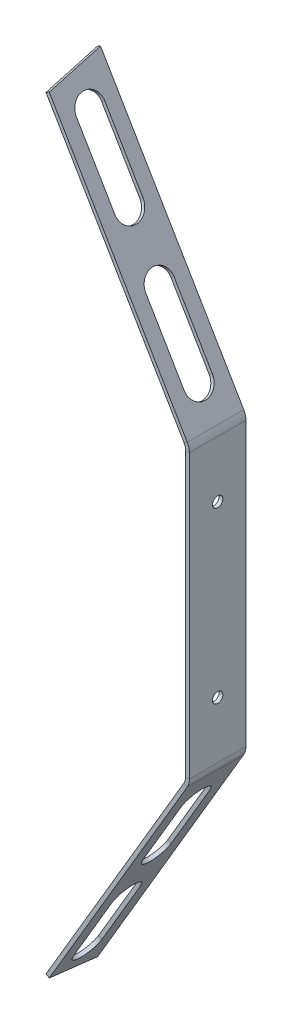
from build123d import *

# Parameters (mm, degrees)
ODGI_CIE_BAZOWE1_DEPTH      = 30
OTW_R_POD_RUB_M51_D         = 5.5
OTW_R_POD_RUB_M51_DEPTH     = 14
OTW_R_POD_RUB_M51_TIP       = 1.652366702
DODANIE_WYCI_GNI_CIE1_DEPTH = 2
DODANIE_WYCI_GNI_CIE2_DEPTH = 2
WYTNIJ_WYCI_GNI_CIE1_DEPTH  = 10
WYTNIJ_WYCI_GNI_CIE3_DEPTH  = 10


# Sheet-metal steps are written as plain solids
with BuildPart() as part:
    # Szkic1 → Odgięcie bazowe1 (new body)
    with BuildSketch(Plane.XY):
        with BuildLine():
            Line((0, 405.16), (73.22194051, 280.801279174))
            ThreePointArc((73.22194051, 280.801279174), (73.876553772, 279.249103741), (74.1, 277.579421472))
            Line((74.1, 277.579421472), (74.1, 127.580578528))
            ThreePointArc((74.1, 127.580578528), (73.876553772, 125.910896259), (73.22194051, 124.358720826))
            Line((73.22194051, 124.358720826), (0, 0))
            Line((0, 0), (1.72344583, -1.014758331))
            Line((1.72344583, -1.014758331), (74.94538634, 123.343962495))
            ThreePointArc((74.94538634, 123.343962495), (75.806177007, 125.38501208), (76.1, 127.580578528))
            Line((76.1, 127.580578528), (76.1, 277.579421472))
            ThreePointArc((76.1, 277.579421472), (75.806177007, 279.77498792), (74.94538634, 281.816037505))
            Line((74.94538634, 281.816037505), (1.72344583, 406.174758331))
            Line((1.72344583, 406.174758331), (0, 405.16))
        make_face()
    extrude(amount=ODGI_CIE_BAZOWE1_DEPTH)

    # Otwór pod śrubę M51
    with Locations(Plane(origin=(76.1, 0, 0), x_dir=(0, 0, -1), z_dir=(1, 0, 0))):
        with Locations((-15, 157.580578528), (-15, 247.579421472)):
            Hole(OTW_R_POD_RUB_M51_D / 2, depth=OTW_R_POD_RUB_M51_DEPTH)
            with Locations((0, 0, -(OTW_R_POD_RUB_M51_DEPTH + OTW_R_POD_RUB_M51_TIP / 2))):  # 118° drill point
                Cone(0, OTW_R_POD_RUB_M51_D / 2, OTW_R_POD_RUB_M51_TIP, mode=Mode.SUBTRACT)

    # Szkic10 → Dodanie-wyciągnięcie1 (add)
    with BuildSketch(Plane(origin=(178.867603803, 105.316562907, 0), x_dir=(0, 0, -1), z_dir=(0.8617229149967045, 0.5073791656833994, 0))):
        Polygon((-30, 349.13565624), (-0.000160653, 354.682794047), (0, 349.13565624), align=None)
    extrude(amount=-DODANIE_WYCI_GNI_CIE1_DEPTH)

    # Szkic11 → Dodanie-wyciągnięcie2 (add)
    with BuildSketch(Plane(origin=(1.72344583, -1.014758331, 0), x_dir=(0, 0, -1), z_dir=(0.8617229149967046, -0.507379165683399, 0))):
        Polygon((-30, 0), (0.008092813, -8.531045483), (0, 0), align=None)
    extrude(amount=-DODANIE_WYCI_GNI_CIE2_DEPTH)

    # Szkic13 → Wytnij-wyciągnięcie1 (cut)
    with BuildSketch(Plane(origin=(0, 0, 0), x_dir=(0, 0, 1), z_dir=(-0.8617229149967046, 0.5073791656833994, 0))):
        with BuildLine():
            Line((7.495953593, 10.734477259), (7.495953593, 50.734477259))
            ThreePointArc((7.495953593, 50.734477259), (14.995953593, 58.234477259), (22.495953593, 50.734477259))
            Line((22.495953593, 50.734477259), (22.495953593, 10.734477259))
            ThreePointArc((22.495953593, 10.734477259), (14.995953593, 3.234477259), (7.495953593, 10.734477259))
        make_face()
        with BuildLine():
            Line((7.495953593, 83.234477259), (7.495953593, 123.234477259))
            ThreePointArc((7.495953593, 123.234477259), (14.995953593, 130.734477259), (22.495953593, 123.234477259))
            Line((22.495953593, 123.234477259), (22.495953593, 83.234477259))
            ThreePointArc((22.495953593, 83.234477259), (14.995953593, 75.734477259), (7.495953593, 83.234477259))
        make_face()
    extrude(amount=-WYTNIJ_WYCI_GNI_CIE1_DEPTH, mode=Mode.SUBTRACT)

    # Szkic12 → Wytnij-wyciągnięcie3 (cut)
    with BuildSketch(Plane(origin=(177.144157973, 104.301804576, 0), x_dir=(0, 0, 1), z_dir=(-0.8617229149967045, -0.5073791656833994, 0))):
        with BuildLine():
            Line((22.500080327, 335.4184445), (22.500080327, 295.4184445))
            ThreePointArc((22.500080327, 295.4184445), (15.000080327, 287.9184445), (7.500080327, 295.4184445))
            Line((7.500080327, 295.4184445), (7.500080327, 335.4184445))
            ThreePointArc((7.500080327, 335.4184445), (15.000080327, 342.9184445), (22.500080327, 335.4184445))
        make_face()
        with BuildLine():
            Line((22.500080327, 262.9184445), (22.500080327, 222.9184445))
            ThreePointArc((22.500080327, 222.9184445), (15.000080327, 215.4184445), (7.500080327, 222.9184445))
            Line((7.500080327, 222.9184445), (7.500080327, 262.9184445))
            ThreePointArc((7.500080327, 262.9184445), (15.000080327, 270.4184445), (22.500080327, 262.9184445))
        make_face()
    extrude(amount=-WYTNIJ_WYCI_GNI_CIE3_DEPTH, mode=Mode.SUBTRACT)


solid = part.part
